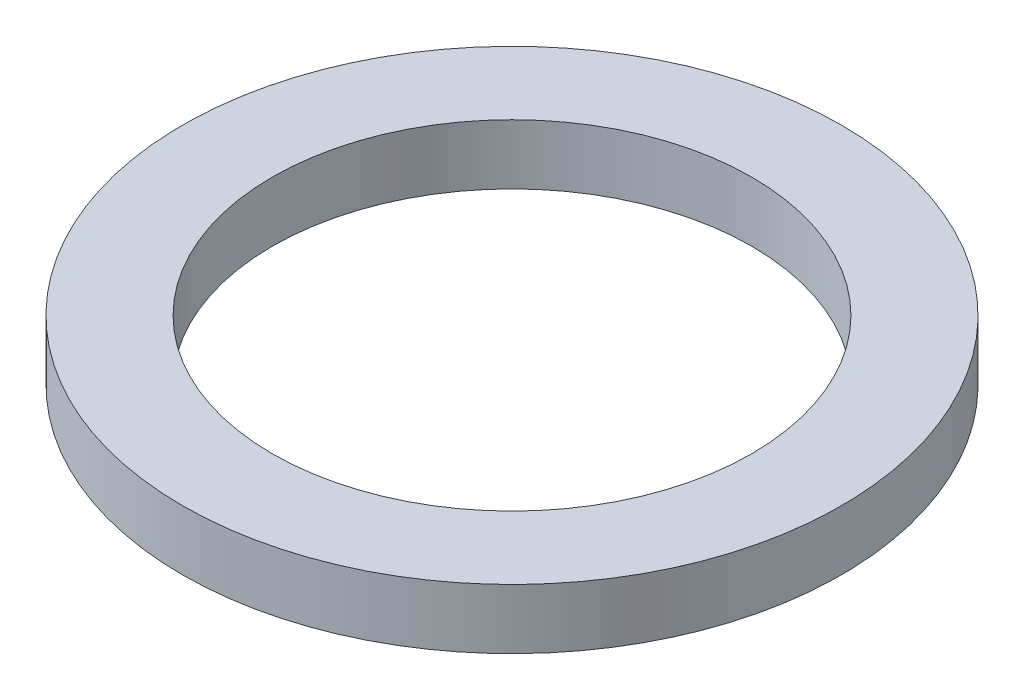
from build123d import *

# Parameters (mm, degrees)
SKETCH1_R           = 27.5
BOSS_EXTRUDE1_DEPTH = 5
SKETCH2_R           = 20
CUT_EXTRUDE1_DEPTH  = 40.210967853


with BuildPart() as part:
    # Sketch1 → Boss-Extrude1 (new body)
    with BuildSketch(Plane(origin=(0, 0, 0), x_dir=(1, 0, 0), z_dir=(0, 1, 0))):
        Circle(SKETCH1_R)
    extrude(amount=BOSS_EXTRUDE1_DEPTH)

    # Sketch2 → Cut-Extrude1 (cut, through all)
    with BuildSketch(Plane(origin=(0, 0, 0), x_dir=(1, 0, 0), z_dir=(0, 1, 0))):
        Circle(SKETCH2_R)
    extrude(amount=CUT_EXTRUDE1_DEPTH, mode=Mode.SUBTRACT)


solid = part.part
